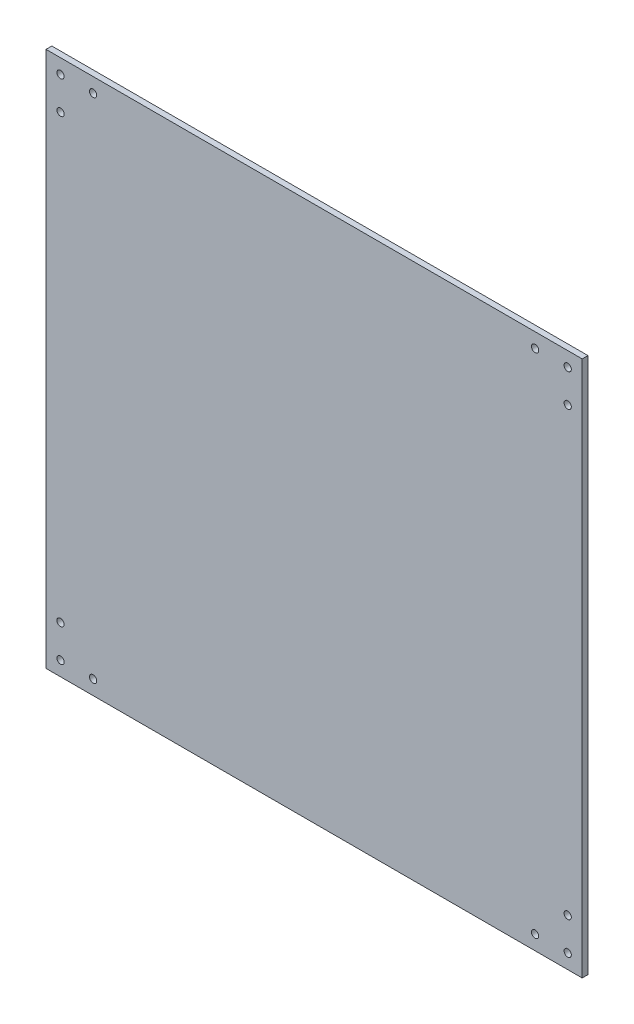
from build123d import *

# Parameters (mm, degrees)
SKETCH_1_W          = 370
SKETCH_1_H          = 370
EXTRUDE_1_DEPTH     = 4
SKETCH_2_R          = 2.5
CUT_EXTRUDE_1_DEPTH = 262.660084843


with BuildPart() as part:
    # 草图1 → 凸台-拉伸1 (new body)
    with BuildSketch(Plane.XY):
        Rectangle(SKETCH_1_W, SKETCH_1_H)
    extrude(amount=EXTRUDE_1_DEPTH)

    # 草图2 → 切除-拉伸1 (cut, through all)
    with BuildSketch(Plane.XY.offset(4)):
        with Locations((-175, -175)):
            Circle(SKETCH_2_R)
        with Locations((-152.5, -175)):
            Circle(SKETCH_2_R)
        with Locations((-175, -152.5)):
            Circle(SKETCH_2_R)
        with Locations((-152.5, 175)):
            Circle(SKETCH_2_R)
        with Locations((-175, 152.5)):
            Circle(SKETCH_2_R)
        with Locations((-175, 175)):
            Circle(SKETCH_2_R)
        with Locations((175, 152.5)):
            Circle(SKETCH_2_R)
        with Locations((152.5, 175)):
            Circle(SKETCH_2_R)
        with Locations((175, 175)):
            Circle(SKETCH_2_R)
        with Locations((152.5, -175)):
            Circle(SKETCH_2_R)
        with Locations((175, -152.5)):
            Circle(SKETCH_2_R)
        with Locations((175, -175)):
            Circle(SKETCH_2_R)
    extrude(amount=-CUT_EXTRUDE_1_DEPTH, mode=Mode.SUBTRACT)


solid = part.part
